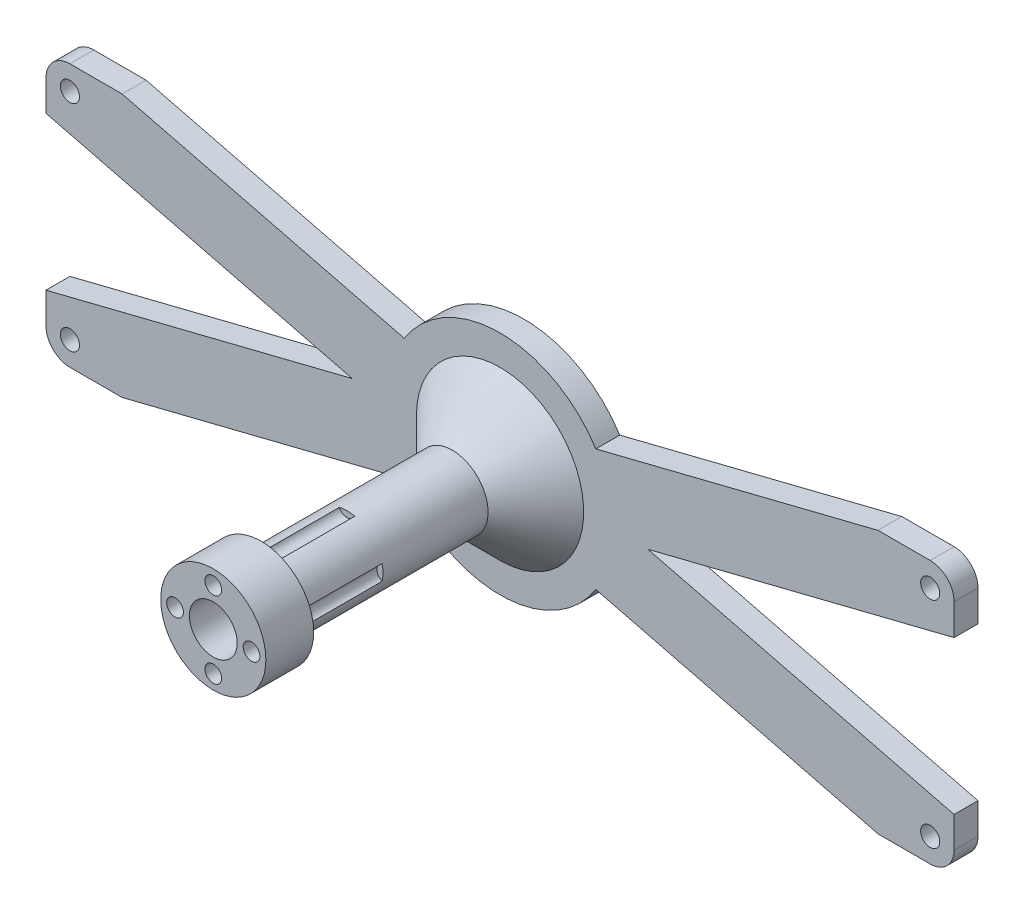
from build123d import *

# Parameters (mm, degrees)
ESBO_O1_R                = 23.75
RESSALTO_EXTRUS_O1_DEPTH = 5
ESBO_O8_R                = 2
RESSALTO_EXTRUS_O2_DEPTH = 5
ESBO_O9_R                = 7.5
ESBO_O9_R_2              = 5
RESSALTO_EXTRUS_O3_DEPTH = 60
RESSALTO_EXTRUS_O4_START = -10
ESBO_O10_R               = 11
ESBO_O10_R_2             = 5
RESSALTO_EXTRUS_O4_DEPTH = 10
ESBO_O11_R               = 1.75
CORTE_EXTRUS_O1_DEPTH    = 28
PADR_OCIRCULAR2_COUNT    = 4
CHANFRO1_SIZE            = 10
FILETE1_R                = 5
FILETE1_OF_ESPELHAR4_R   = 5
ESPELHAR5_OUTLINE_R      = 2
ESPELHAR5_DEPTH          = 5


# Read off the part's stored shape, not the designer's step: Espelhar5
with BuildPart() as part:
    # Esboço1 → Ressalto-extrusão1 (new body)
    with BuildSketch(Plane.XY):
        Circle(ESBO_O1_R)
    extrude(amount=RESSALTO_EXTRUS_O1_DEPTH)

    # Esboço8 → Ressalto-extrusão2 (add)
    with BuildSketch(Plane.XY.offset(5)):
        Polygon((-20.042848617, 12.741535202), (-79.076707808, 27.5), (-95, 27.5), (-95, 16.019176952), (-23.680882993, -1.8106023), align=None)
        with Locations((-90, 22.5)):
            Circle(ESBO_O8_R, mode=Mode.SUBTRACT)
    ressalto_extrus_o2 = extrude(amount=-RESSALTO_EXTRUS_O2_DEPTH)

    # Esboço9 → Ressalto-extrusão3 (add)
    with BuildSketch(Plane.XY.offset(5)):
        Circle(ESBO_O9_R)
        Circle(ESBO_O9_R_2, mode=Mode.SUBTRACT)
    extrude(amount=RESSALTO_EXTRUS_O3_DEPTH)

    # Esboço10 → Ressalto-extrusão4 (add)
    with BuildSketch(Plane.XY.offset(65).offset(RESSALTO_EXTRUS_O4_START)):
        Circle(ESBO_O10_R)
        Circle(ESBO_O10_R_2, mode=Mode.SUBTRACT)
    extrude(amount=RESSALTO_EXTRUS_O4_DEPTH)

    # Esboço11 → Corte-extrusão1 (cut)
    with BuildSketch(Plane.XY.offset(65)):
        with Locations((0, -8)):
            Circle(ESBO_O11_R)
    corte_extrus_o1 = extrude(amount=-CORTE_EXTRUS_O1_DEPTH, mode=Mode.SUBTRACT)

    # PadrãoCircular2: Corte-extrusão1 ×4 about axis
    padr_ocircular2_axis = Axis((0, 0, 0), (0, 0, 1))
    for i in range(1, PADR_OCIRCULAR2_COUNT):
        add(corte_extrus_o1.rotate(padr_ocircular2_axis, i * 360 / PADR_OCIRCULAR2_COUNT), mode=Mode.SUBTRACT)

    # Chanfro1
    chanfro1_edges = [part.edges().sort_by_distance(p)[0] for p in [
        (-7.5, 0, 5),
    ]]
    chamfer(chanfro1_edges, length=CHANFRO1_SIZE)

    # Filete1
    filete1_edges = [part.edges().sort_by_distance(p)[0] for p in [
        (-95, 27.5, 2.5),
    ]]
    fillet(filete1_edges, radius=FILETE1_R)

    # Espelhar4: Ressalto-extrusão2 across plane
    add(ressalto_extrus_o2.mirror(Plane.ZX))

    # Filete1 of Espelhar4
    filete1_of_espelhar4_edges = [part.edges().sort_by_distance(p)[0] for p in [
        (-95, -27.5, 2.5),
    ]]
    fillet(filete1_of_espelhar4_edges, radius=FILETE1_OF_ESPELHAR4_R)

    # Espelhar5 outline → Espelhar5 (add)
    with BuildSketch(Plane.XY):
        with BuildLine():
            Line((95, -22.5), (95, -16.019176952))
            Line((95, -16.019176952), (30.923292192, 0))
            Line((30.923292192, 0), (95, 16.019176952))
            Line((95, 16.019176952), (95, 22.5))
            ThreePointArc((95, 22.5), (93.535533906, 26.035533906), (90, 27.5))
            Line((90, 27.5), (79.076707808, 27.5))
            Line((79.076707808, 27.5), (20.042848617, 12.741535202))
            ThreePointArc((20.042848617, 12.741535202), (23.75, 0), (20.042848617, -12.741535202))
            Line((20.042848617, -12.741535202), (79.076707808, -27.5))
            Line((79.076707808, -27.5), (90, -27.5))
            ThreePointArc((90, -27.5), (93.535533906, -26.035533906), (95, -22.5))
        make_face()
        with Locations((90, -22.5)):
            Circle(ESPELHAR5_OUTLINE_R, mode=Mode.SUBTRACT)
        with Locations((90, 22.5)):
            Circle(ESPELHAR5_OUTLINE_R, mode=Mode.SUBTRACT)
    extrude(amount=ESPELHAR5_DEPTH)


solid = part.part
